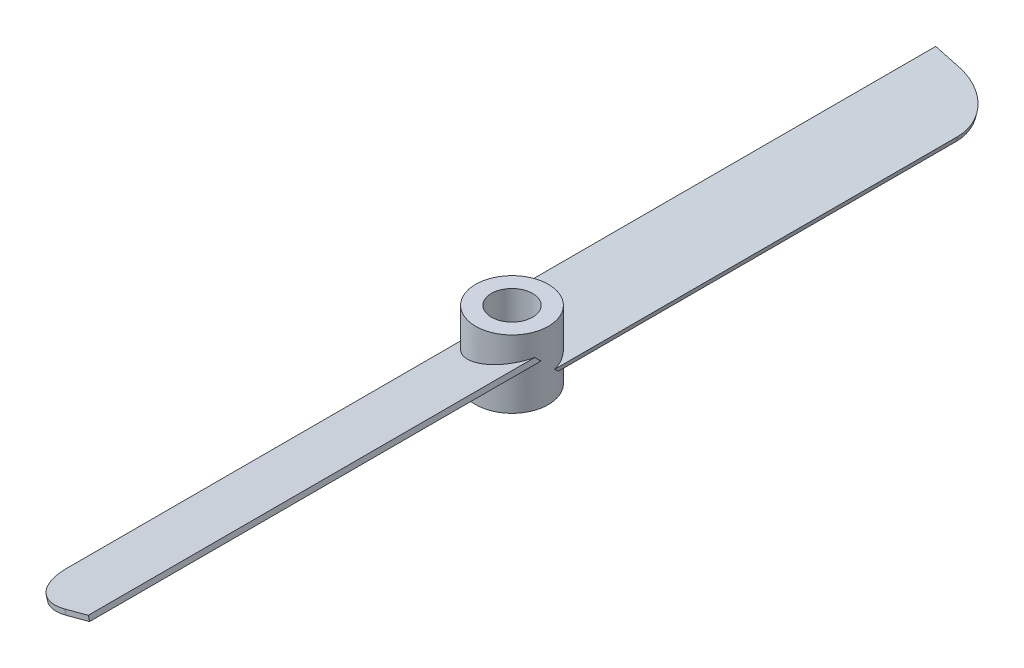
from build123d import *

# Parameters (mm, degrees)
SKETCH1_R           = 7.5
BOSS_EXTRUDE2_DEPTH = 14
CUT_EXTRUDE1_REACH  = 19.564
SKETCH2_R           = 4.25
BOSS_EXTRUDE3_START = -7.279118874
BOSS_EXTRUDE3_DEPTH = 1.03527618
FILLET1_R           = 10
CIRPATTERN1_COUNT   = 2
FILLET3_R           = 10


with BuildPart() as part:
    # Sketch1 → Boss-Extrude2 (new body)
    with BuildSketch(Plane(origin=(0, 0, 0), x_dir=(1, 0, 0), z_dir=(0, 1, 0))):
        with Locations(Location((0, 0, 0), (0, 0, 270))):
            Circle(SKETCH1_R)
    extrude(amount=BOSS_EXTRUDE2_DEPTH)

    # Sketch2 → Cut-Extrude1 (cut, up to next)
    with BuildSketch(Plane(origin=(0, 14, 0), x_dir=(1, 0, 0), z_dir=(0, 1, 0)), mode=Mode.PRIVATE) as cut_extrude1_sk1:
        with Locations(Location((0, 0, 0), (0, 0, 270))):
            Circle(SKETCH2_R)
    cut_extrude1_tool1 = extrude(cut_extrude1_sk1.sketch, amount=-CUT_EXTRUDE1_REACH, mode=Mode.PRIVATE) & part.part
    add(cut_extrude1_tool1.solids().sort_by_distance((0, 14, 0))[0], mode=Mode.SUBTRACT)

    # Boss-Extrude3: read off the stored shape, not the designer's step
    # Boss-Extrude3 outline → Boss-Extrude3 (add)
    with BuildSketch(Plane(origin=(0, 0, 0), x_dir=(0.9659258262890672, 0.2588190451025251, 0), z_dir=(0.25881904510252507, -0.9659258262890672, 0)).offset(BOSS_EXTRUDE3_START)):
        with BuildLine():
            add(Edge.make_bspline(
                [(-5.688266684, 1.344969698), (-4.547659305, 7.389056985), (1.811733316, 7.498803292)],
                knots=[0.18030465, 0.18030465, 0.18030465, 1.551469461, 1.551469461, 1.551469461], degree=2, weights=[1, 0.771122328, 0.993637519]))
            add(Edge.make_bspline(
                [(1.811733316, 7.498803292), (8.171125936, 7.389056985), (9.311733316, 1.344969698)],
                knots=[1.590123193, 1.590123193, 1.590123193, 2.961288004, 2.961288004, 2.961288004], degree=2, weights=[0.993637519, 0.771122328, 1]))
            Line((9.311733316, 1.344969698), (9.311733316, 94.5))
            Line((9.311733316, 94.5), (-5.688266684, 94.5))
            Line((-5.688266684, 94.5), (-5.688266684, 1.344969698))
        make_face()
    boss_extrude3 = extrude(amount=BOSS_EXTRUDE3_DEPTH)

    # Fillet1
    fillet1_edges = [part.edges().sort_by_distance(p)[0] for p in [
        (-7.244443697, 5.058857162, 94.5),
    ]]
    fillet(fillet1_edges, radius=FILLET1_R)

    # CirPattern1: Boss-Extrude3 ×2 about axis
    cirpattern1_axis = Axis((0, 0, 0), (0, 1, 0))
    for i in range(1, CIRPATTERN1_COUNT):
        add(boss_extrude3.rotate(cirpattern1_axis, i * 360 / CIRPATTERN1_COUNT))

    # Fillet3
    fillet3_edges = [part.edges().sort_by_distance(p)[0] for p in [
        (7.244443697, 5.058857162, -94.5),
    ]]
    fillet(fillet3_edges, radius=FILLET3_R)


solid = part.part
